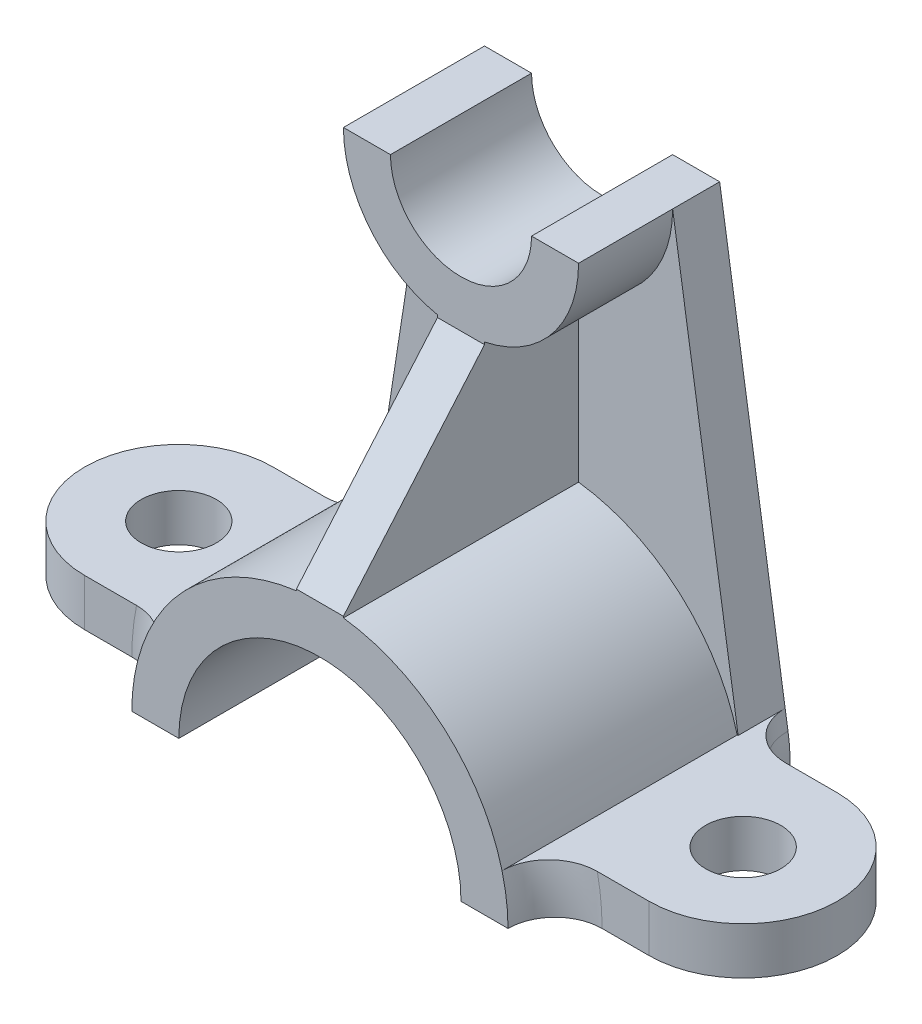
from build123d import *

# Parameters (mm, degrees)
BOSS_EXTRUDE1_DEPTH  = 60
BOSS_EXTRUDE2_DEPTH  = 30
BOSS_EXTRUDE3_DEPTH  = 10
BOSS_EXTRUDE4_DEPTH  = 10
FILLET1_R            = 10
FILLET1_OF_MIRROR2_R = 10
SKETCH13_R           = 8
CUT_EXTRUDE1_DEPTH   = 135.53624053
RIB1_START           = -5
RIB1_DEPTH           = 10


with BuildPart() as part:
    # Sketch2 → Boss-Extrude1 (new body)
    with BuildSketch(Plane.XY):
        with BuildLine():
            ThreePointArc((-30, 0), (-21.213203436, 21.213203436), (0, 30))
            Line((0, 30), (0, 40))
            ThreePointArc((0, 40), (-28.284271247, 28.284271247), (-40, 0))
            Line((-40, 0), (-30, 0))
        make_face()
        with BuildLine():
            Line((0, 40), (0, 30))
            ThreePointArc((0, 30), (21.213203436, 21.213203436), (30, 0))
            Line((30, 0), (40, 0))
            ThreePointArc((40, 0), (28.284271247, 28.284271247), (0, 40))
        make_face()
    extrude(amount=BOSS_EXTRUDE1_DEPTH)



with BuildPart() as body_2:
    # Sketch2<3> → Boss-Extrude2 (new body)
    with BuildSketch(Plane.XY):
        with BuildLine():
            Line((-25, 100), (-15, 100))
            ThreePointArc((-15, 100), (0, 85), (15, 100))
            Line((15, 100), (25, 100))
            ThreePointArc((25, 100), (0, 75), (-25, 100))
        make_face()
    extrude(amount=BOSS_EXTRUDE2_DEPTH)


with BuildPart() as part_1:
    add(part.part)

    add(body_2.part)  # Boss-Extrude3 merges body 2
    # Sketch8 → Boss-Extrude3 (add)
    with BuildSketch(Plane(origin=(0, 0, 0), x_dir=(-1, 0, 0), z_dir=(0, 0, -1))):
        with BuildLine():
            Line((-25, 100), (-39.529411765, 6.117647059))
            ThreePointArc((-39.529411765, 6.117647059), (0, 40), (39.529411765, 6.117647059))
            Line((39.529411765, 6.117647059), (25, 100))
            ThreePointArc((25, 100), (0, 75), (-25, 100))
        make_face()
    extrude(amount=-BOSS_EXTRUDE3_DEPTH)

    # Sketch10 → Boss-Extrude4 (add)
    with BuildSketch(Plane.XZ):
        with BuildLine():
            Line((35, 50), (60, 50))
            ThreePointArc((60, 50), (80, 30), (60, 10))
            Line((60, 10), (35, 10))
            Line((35, 10), (35, 50))
        make_face()
    boss_extrude4 = extrude(amount=-BOSS_EXTRUDE4_DEPTH)

    # Fillet1
    fillet1_edges = [part_1.edges().sort_by_distance(p)[0] for p in [
        (39.228991597, 8.058823529, 10),
        (39.88217942, 3.067859955, 10),
        (39.681187851, 5.040171699, 50),
    ]]
    fillet(fillet1_edges, radius=FILLET1_R - 0.0001)  # a hair under: the kernel refuses the full size

    # Mirror2: Boss-Extrude4 across plane
    add(boss_extrude4.mirror(Plane(origin=(0, 0, 0), x_dir=(0, 0, 1), z_dir=(1, 0, 0))))

    # Fillet1 of Mirror2
    fillet1_of_mirror2_edges = [part_1.edges().sort_by_distance(p)[0] for p in [
        (-39.228991597, 8.058823529, 10),
        (-39.88217942, 3.067859955, 10),
        (-39.681187851, 5.040171699, 50),
    ]]
    fillet(fillet1_of_mirror2_edges, radius=FILLET1_OF_MIRROR2_R - 0.0001)  # a hair under: the kernel refuses the full size

    # Sketch13 → Cut-Extrude1 (cut, through all)
    with BuildSketch(Plane(origin=(0, 10, 0), x_dir=(1, 0, 0), z_dir=(0, 1, 0))):
        with Locations(Location((60, -30, 0), (0, 0, 270))):
            Circle(SKETCH13_R)
        with Locations(Location((-60, -30, 0), (0, 0, 270))):
            Circle(SKETCH13_R)
    extrude(amount=-CUT_EXTRUDE1_DEPTH, mode=Mode.SUBTRACT)

    # Rib1: read off the stored shape, not the designer's step
    # Rib1 outline → Rib1 (add)
    with BuildSketch(Plane(origin=(0, 0, 0), x_dir=(0, 0, -1), z_dir=(1, 0, 0)).offset(RIB1_START)):
        Polygon((-60, 40), (-60, 39.686269666), (-10, 39.686269666), (-10, 75.505102572), (-30, 75.505102572), (-30, 75), align=None)
    extrude(amount=RIB1_DEPTH)


solid = part_1.part
